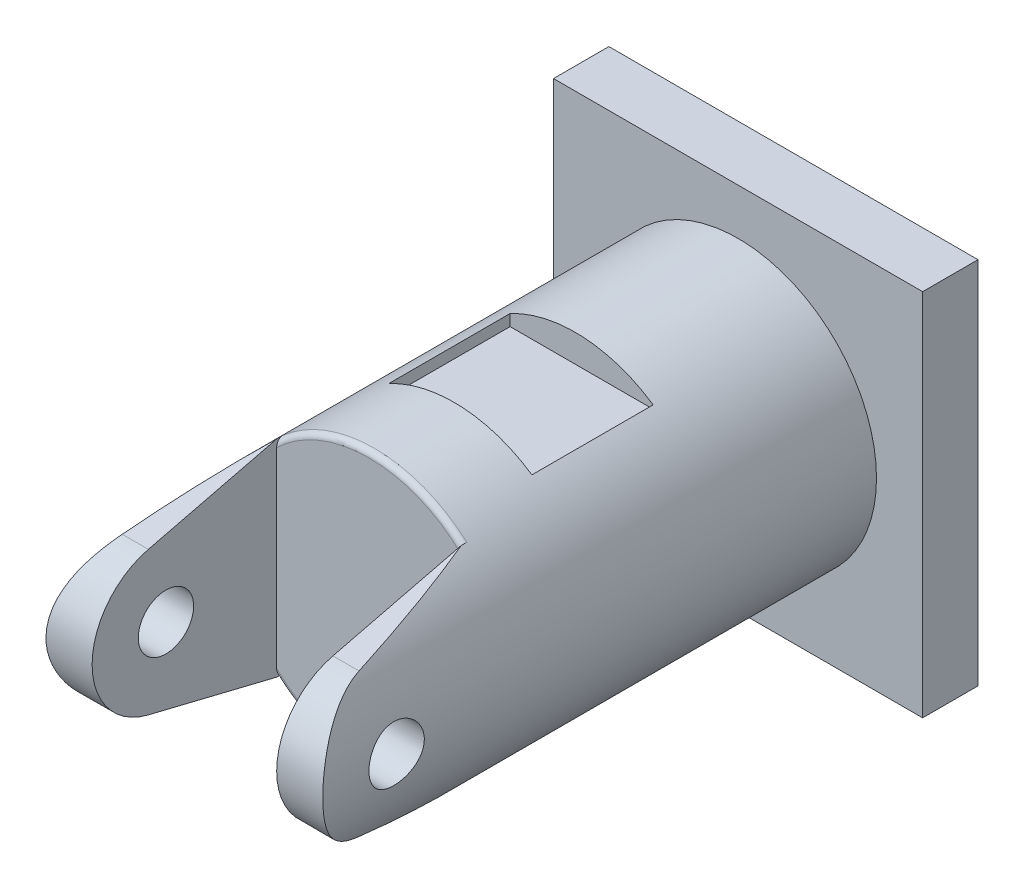
from build123d import *

# Parameters (mm, degrees)
CROQUIS1_R                 = 7.5
SALIENTE_EXTRUIR1_DEPTH    = 30
CORTAR_EXTRUIR1_DEPTH      = 32.819805153
CORTAR_EXTRUIR1_DEPTH_BACK = 10
CROQUIS2_W                 = 10
CROQUIS2_H                 = 15.47925891
CORTAR_EXTRUIR3_DEPTH      = 32.819805153
CORTAR_EXTRUIR3_DEPTH_BACK = 32.819805153
CORTAR_EXTRUIR4_DEPTH      = 32.819805295
CORTAR_EXTRUIR4_DEPTH_BACK = 32.819805295
CROQUIS4_R                 = 1.5
REDONDEO1_R                = 0.3
CROQUIS5_W                 = 20
CROQUIS5_H                 = 20
SALIENTE_EXTRUIR2_DEPTH    = 3
CORTAR_EXTRUIR5_START      = 6
CROQUIS6_W                 = 7.750181945
CROQUIS6_H                 = 6.56920184
CORTAR_EXTRUIR5_DEPTH      = 10


with BuildPart() as part:
    # Croquis1 → Saliente-Extruir1 (new body)
    with BuildSketch(Plane.XY):
        Circle(CROQUIS1_R)
    extrude(amount=SALIENTE_EXTRUIR1_DEPTH)

    # Croquis2 → Cortar-Extruir1 (cut, two sides: drawn at the far end of the back side and taken through both)
    with BuildSketch(Plane.XY.offset(30).offset(-CORTAR_EXTRUIR1_DEPTH_BACK)):
        Rectangle(CROQUIS2_W, CROQUIS2_H)
    extrude(amount=CORTAR_EXTRUIR1_DEPTH + CORTAR_EXTRUIR1_DEPTH_BACK, mode=Mode.SUBTRACT)

    # Croquis3 → Cortar-Extruir3 (cut, two sides: drawn at the far end of the back side and taken through both)
    with BuildSketch(Plane(origin=(0, 0, 0), x_dir=(0, 0, -1), z_dir=(1, 0, 0)).offset(-CORTAR_EXTRUIR3_DEPTH_BACK)):
        with BuildLine():
            Line((-20, 67.5), (-20, 7.5))
            Line((-20, 7.5), (-20, 5.590169944))
            Line((-20, 5.590169944), (-26.952923855, 3.884664175))
            ThreePointArc((-26.952923855, 3.884664175), (-29.999999999, -0.000262165), (-26.952744721, -3.885047998))
            Line((-26.952744721, -3.885047998), (-20, -5.590169944))
            Line((-20, -5.590169944), (-20, -7.5))
            Line((-20, -7.5), (-20, -67.5))
            Line((-20, -67.5), (-140, -67.5))
            Line((-140, -67.5), (-140, 67.5))
            Line((-140, 67.5), (-20, 67.5))
        make_face()
    extrude(amount=CORTAR_EXTRUIR3_DEPTH + CORTAR_EXTRUIR3_DEPTH_BACK, mode=Mode.SUBTRACT)

    # Croquis4 → Cortar-Extruir4 (cut, two sides: drawn at the far end of the back side and taken through both)
    with BuildSketch(Plane(origin=(0, 0, 0), x_dir=(0, 0, -1), z_dir=(1, 0, 0)).offset(-CORTAR_EXTRUIR4_DEPTH_BACK)):
        with Locations(Location((-26, -0.000169944, 0), (0, 0, 90))):
            Circle(CROQUIS4_R)
    extrude(amount=CORTAR_EXTRUIR4_DEPTH + CORTAR_EXTRUIR4_DEPTH_BACK, mode=Mode.SUBTRACT)

    # Redondeo1
    # the kernel refuses this fillet: 0.3 mm, written as the material it takes off along each edge
    with BuildSketch(Plane(origin=(0, 0, 20), x_dir=(0.7377709544179419, -0.6750511231138268, 0), z_dir=(0.6750511231138268, 0.7377709544179419, 0))) as redondeo1_piece_1_section:
        with BuildLine():
            CenterArc((7.5 - REDONDEO1_R, REDONDEO1_R), REDONDEO1_R, 270, 90)
            Line((7.5 - REDONDEO1_R, 0), (7.5, 0))
            Line((7.5, 0), (7.5, REDONDEO1_R))
        make_face()
    redondeo1_piece_1 = revolve(axis=Axis((0, 0, 20), (0, 0, -1)), revolution_arc=95.083759333, mode=Mode.PRIVATE)
    redondeo1_piece_1 = split(redondeo1_piece_1, bisect_by=Plane(origin=(5, -5.527382777, 19.949282133), z_dir=(-1, 0, 0)), keep=Keep.TOP, mode=Mode.PRIVATE)
    redondeo1_piece_1 = split(redondeo1_piece_1, bisect_by=Plane(origin=(-5, -5.527382777, 19.949282133), z_dir=(1, 0, 0)), keep=Keep.TOP, mode=Mode.PRIVATE)
    add(redondeo1_piece_1, mode=Mode.SUBTRACT)
    with BuildSketch(Plane(origin=(0, 0, 20), x_dir=(-0.737770954417942, 0.6750511231138266, 0), z_dir=(-0.6750511231138266, -0.737770954417942, 0))) as redondeo1_piece_2_section:
        with BuildLine():
            CenterArc((7.5 - REDONDEO1_R, REDONDEO1_R), REDONDEO1_R, 270, 90)
            Line((7.5 - REDONDEO1_R, 0), (7.5, 0))
            Line((7.5, 0), (7.5, REDONDEO1_R))
        make_face()
    redondeo1_piece_2 = revolve(axis=Axis((0, 0, 20), (0, 0, -1)), revolution_arc=95.083759333, mode=Mode.PRIVATE)
    redondeo1_piece_2 = split(redondeo1_piece_2, bisect_by=Plane(origin=(5, 5.527385531, 19.949280237), z_dir=(-1, 0, 0)), keep=Keep.TOP, mode=Mode.PRIVATE)
    redondeo1_piece_2 = split(redondeo1_piece_2, bisect_by=Plane(origin=(-5, 5.527385531, 19.949280237), z_dir=(1, 0, 0)), keep=Keep.TOP, mode=Mode.PRIVATE)
    add(redondeo1_piece_2, mode=Mode.SUBTRACT)

    # Croquis5 → Saliente-Extruir2 (add)
    with BuildSketch(Plane(origin=(0, 0, 0), x_dir=(-1, 0, 0), z_dir=(0, 0, -1))):
        Rectangle(CROQUIS5_W, CROQUIS5_H)
    extrude(amount=SALIENTE_EXTRUIR2_DEPTH)

    # Croquis6 → Cortar-Extruir5 (cut)
    with BuildSketch(Plane(origin=(0, 0, 0), x_dir=(1, 0, 0), z_dir=(0, 1, 0)).offset(CORTAR_EXTRUIR5_START)):
        with Locations((0.339668607, -12.101574185)):
            Rectangle(CROQUIS6_W, CROQUIS6_H)
    extrude(amount=CORTAR_EXTRUIR5_DEPTH, mode=Mode.SUBTRACT)


solid = part.part
